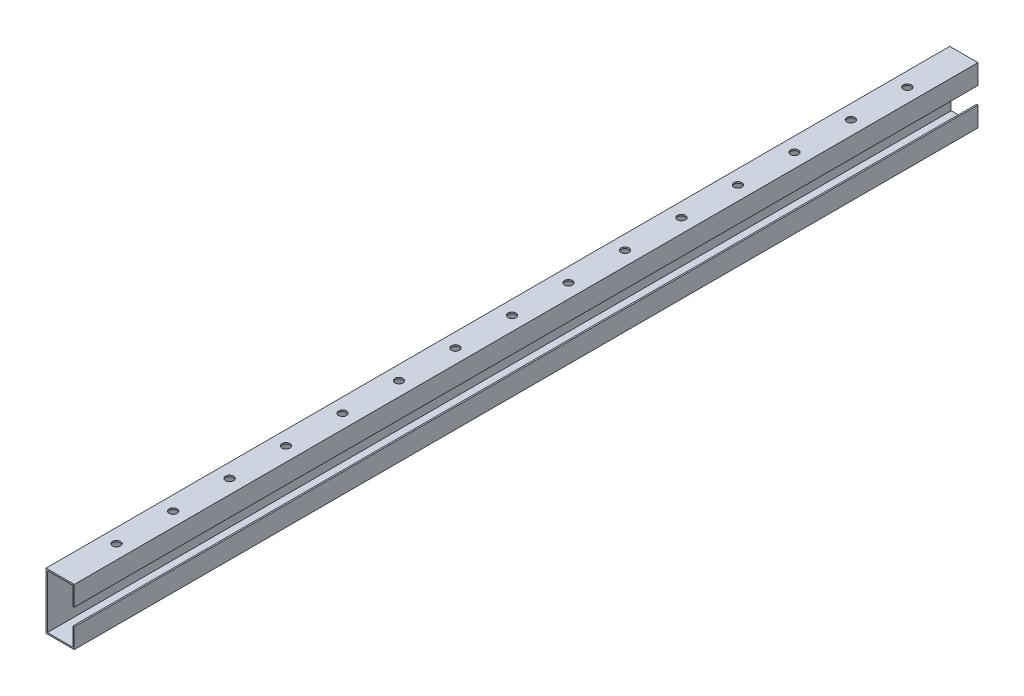
from build123d import *

# Parameters (mm, degrees)
CROQUIS1_W              = 50
CROQUIS1_H              = 100
CROQUIS1_W_2            = 45
CROQUIS1_H_2            = 95
SALIENTE_EXTRUIR1_DEPTH = 800
CROQUIS2_W              = 1600
CROQUIS2_H              = 30
CORTAR_EXTRUIR1_DEPTH   = 5
CROQUIS8_R              = 7.14375
CORTAR_EXTRUIR2_DEPTH   = 130


with BuildPart() as part:
    # Croquis1 → Saliente-Extruir1 (new, symmetric)
    with BuildSketch(Plane.XY):
        Rectangle(CROQUIS1_W, CROQUIS1_H)
        Rectangle(CROQUIS1_W_2, CROQUIS1_H_2, mode=Mode.SUBTRACT)
    extrude(amount=SALIENTE_EXTRUIR1_DEPTH, both=True)

    # Croquis2 → Cortar-Extruir1 (cut)
    with BuildSketch(Plane(origin=(25, 0, 0), x_dir=(0, 0, -1), z_dir=(1, 0, 0))):
        Rectangle(CROQUIS2_W, CROQUIS2_H)
    extrude(amount=-CORTAR_EXTRUIR1_DEPTH, mode=Mode.SUBTRACT)

    # Croquis8 → Cortar-Extruir2 (cut)
    with BuildSketch(Plane(origin=(25, 50, 0), x_dir=(0, 0, 1), z_dir=(0, -1, 0))):
        with Locations((0, 25)):
            Circle(CROQUIS8_R)
        with Locations((100, 25)):
            Circle(CROQUIS8_R)
        with Locations((200, 25)):
            Circle(CROQUIS8_R)
        with Locations((300, 25)):
            Circle(CROQUIS8_R)
        with Locations((400, 25)):
            Circle(CROQUIS8_R)
        with Locations((500, 25)):
            Circle(CROQUIS8_R)
        with Locations((600, 25)):
            Circle(CROQUIS8_R)
        with Locations((700, 25)):
            Circle(CROQUIS8_R)
        with Locations((-100, 25)):
            Circle(CROQUIS8_R)
        with Locations((-200, 25)):
            Circle(CROQUIS8_R)
        with Locations((-300, 25)):
            Circle(CROQUIS8_R)
        with Locations((-400, 25)):
            Circle(CROQUIS8_R)
        with Locations((-500, 25)):
            Circle(CROQUIS8_R)
        with Locations((-600, 25)):
            Circle(CROQUIS8_R)
        with Locations((-700, 25)):
            Circle(CROQUIS8_R)
    extrude(amount=CORTAR_EXTRUIR2_DEPTH, mode=Mode.SUBTRACT)


solid = part.part
